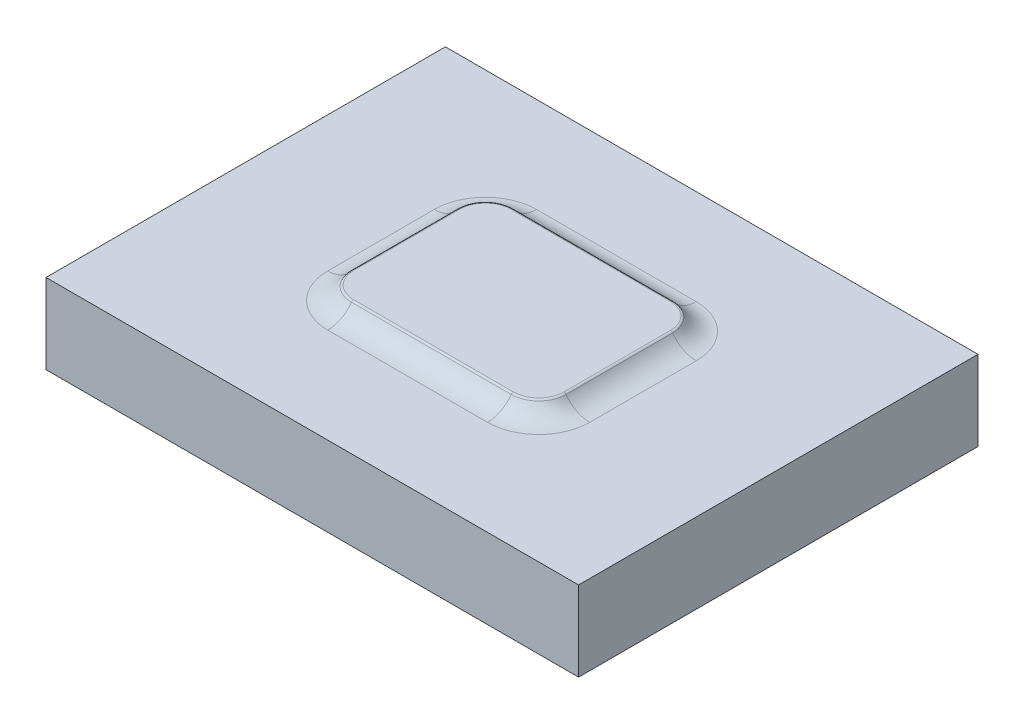
from build123d import *

# Parameters (mm, degrees)
SKETCH_1_W      = 20
SKETCH_1_H      = 15
EXTRUDE_1_DEPTH = 3
SKETCH_2_W      = 8
SKETCH_2_H      = 6
EXTRUDE_2_DEPTH = 0.5
FILLET_1_R      = 1
FILLET_2_R      = 1.1
FILLET_3_R      = 0.1


with BuildPart() as part:
    # 草图1 → 凸台-拉伸1 (new body)
    with BuildSketch(Plane(origin=(0, 0, 0), x_dir=(1, 0, 0), z_dir=(0, 1, 0))):
        Rectangle(SKETCH_1_W, SKETCH_1_H)
    extrude(amount=EXTRUDE_1_DEPTH)

    # 草图2 → 凸台-拉伸2 (add)
    with BuildSketch(Plane(origin=(0, 3, 0), x_dir=(1, 0, 0), z_dir=(0, 1, 0))):
        Rectangle(SKETCH_2_W, SKETCH_2_H)
    extrude(amount=EXTRUDE_2_DEPTH)

    # 圆角1
    fillet_1_edges = [part.edges().sort_by_distance(p)[0] for p in [
        (-4, 3.25, -3),
        (-4, 3.25, 3),
        (4, 3.25, 3),
        (4, 3.25, -3),
    ]]
    fillet(fillet_1_edges, radius=FILLET_1_R)

    # 圆角2
    # the kernel refuses this fillet: 1.1 mm, written as the material it adds along each edge
    with BuildSketch(Plane(origin=(3, 3, 2), x_dir=(0, 0, 1), z_dir=(-1, 0, 0))) as fillet_2_piece_1:
        with BuildLine():
            CenterArc((1.921954446, 1.1), FILLET_2_R, 213.055731151, 56.944268849)
            Line((1, 0.5), (0.981560911, 0.488))
            ThreePointArc((0.981560911, 0.488), (0.978, 0.25), (0.978, 0))
            Line((0.978, 0), (1, -0.022))
            Line((1, -0.022), (1.921954446, -0.022))
            Line((1.921954446, -0.022), (1.921954446, 0))
        make_face()
    revolve(axis=Axis((3, 3, 2), (0, 1, 0)), revolution_arc=90)
    with BuildSketch(Plane(origin=(-3, 3, 3), x_dir=(0, 0, 1), z_dir=(1, 0, 0)), Plane(origin=(3, 3, -3), x_dir=(0, 0, -1), z_dir=(-1, 0, 0))) as fillet_2_piece_2:
        with BuildLine():
            CenterArc((0.921954446, -1.1), FILLET_2_R, 90, 56.944268849)
            Line((0, -0.5), (-0.018439089, -0.488))
            ThreePointArc((-0.018439089, -0.488), (-0.022, -0.25), (-0.022, 0))
            Line((-0.022, 0), (0, 0.022))
            Line((0, 0.022), (0.921954446, 0.022))
            Line((0.921954446, 0.022), (0.921954446, 0))
        make_face()
    extrude(amount=6)
    with BuildSketch(Plane(origin=(-3, 3, 2), x_dir=(-1, 0, 0), z_dir=(0, 0, -1))) as fillet_2_piece_3:
        with BuildLine():
            CenterArc((1.921954446, 1.1), FILLET_2_R, 213.055731151, 56.944268849)
            Line((1, 0.5), (0.981560911, 0.488))
            ThreePointArc((0.981560911, 0.488), (0.978, 0.25), (0.978, 0))
            Line((0.978, 0), (1, -0.022))
            Line((1, -0.022), (1.921954446, -0.022))
            Line((1.921954446, -0.022), (1.921954446, 0))
        make_face()
    revolve(axis=Axis((-3, 3, 2), (0, 1, 0)), revolution_arc=90)
    with BuildSketch(Plane(origin=(-4, 3, -2), x_dir=(-1, 0, 0), z_dir=(0, 0, 1)), Plane(origin=(4, 3, 2), x_dir=(1, 0, 0), z_dir=(0, 0, -1))) as fillet_2_piece_4:
        with BuildLine():
            CenterArc((0.921954446, -1.1), FILLET_2_R, 90, 56.944268849)
            Line((0, -0.5), (-0.018439089, -0.488))
            ThreePointArc((-0.018439089, -0.488), (-0.022, -0.25), (-0.022, 0))
            Line((-0.022, 0), (0, 0.022))
            Line((0, 0.022), (0.921954446, 0.022))
            Line((0.921954446, 0.022), (0.921954446, 0))
        make_face()
    extrude(amount=4)
    with BuildSketch(Plane(origin=(-3, 3, -2), x_dir=(0, 0, -1), z_dir=(1, 0, 0))) as fillet_2_piece_5:
        with BuildLine():
            CenterArc((1.921954446, 1.1), FILLET_2_R, 213.055731151, 56.944268849)
            Line((1, 0.5), (0.981560911, 0.488))
            ThreePointArc((0.981560911, 0.488), (0.978, 0.25), (0.978, 0))
            Line((0.978, 0), (1, -0.022))
            Line((1, -0.022), (1.921954446, -0.022))
            Line((1.921954446, -0.022), (1.921954446, 0))
        make_face()
    revolve(axis=Axis((-3, 3, -2), (0, 1, 0)), revolution_arc=90)
    with BuildSketch(Plane(origin=(3, 3, -2), x_dir=(0, 0, -1), z_dir=(-1, 0, 0))) as fillet_2_piece_6:
        with BuildLine():
            CenterArc((1.921954446, -1.1), FILLET_2_R, 90, 56.944268849)
            Line((1, -0.5), (0.981560911, -0.488))
            ThreePointArc((0.981560911, -0.488), (0.978, -0.25), (0.978, 0))
            Line((0.978, 0), (1, 0.022))
            Line((1, 0.022), (1.921954446, 0.022))
            Line((1.921954446, 0.022), (1.921954446, 0))
        make_face()
    revolve(axis=Axis((3, 3, -2), (0, -1, 0)), revolution_arc=90)

    # 圆角3
    fillet_3_edges = [part.edges().sort_by_distance(p)[0] for p in [
        (-4, 3.5, 0),
        (0, 3.5, -3),
        (0, 3.5, 3),
        (4, 3.5, 0),
        (-3.707106781, 3.5, 2.707106781),
        (3.707106781, 3.5, 2.707106781),
        (3.707106781, 3.5, -2.707106781),
        (-3.707106781, 3.5, -2.707106781),
    ]]
    fillet(fillet_3_edges, radius=FILLET_3_R)


solid = part.part
